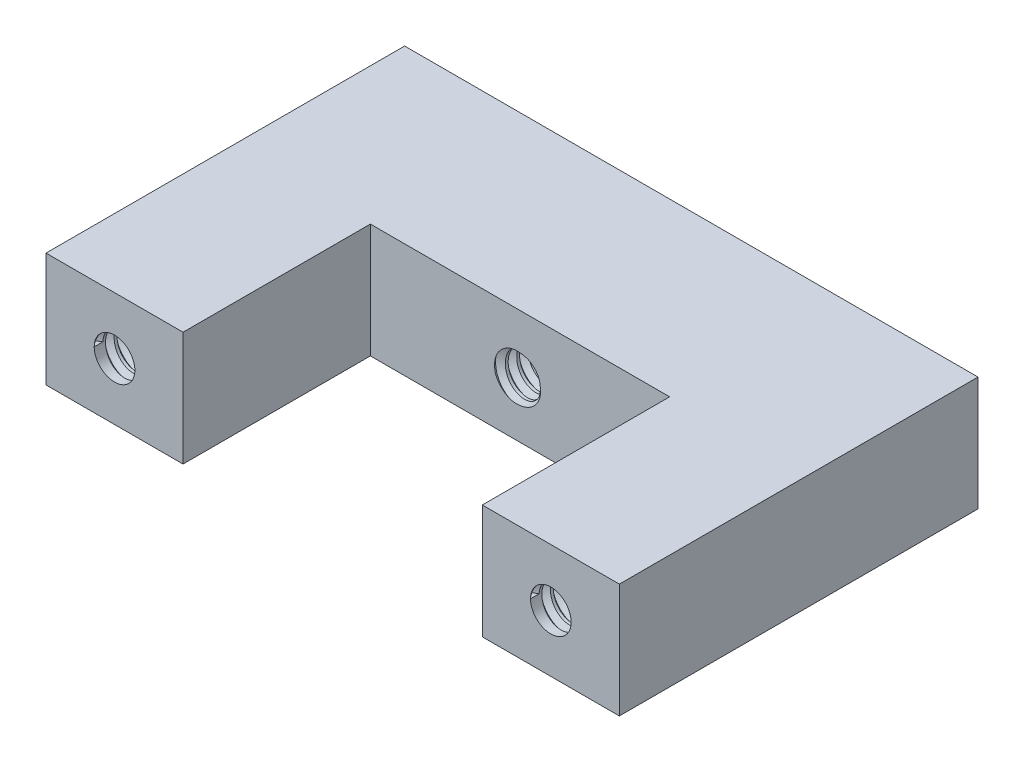
from build123d import *

# Parameters (mm, degrees)
BOSS_EXTRUDE1_DEPTH             = 6.35
F_43_0_089_DIAMETER_HOLE1_D     = 2.2606
THREAD1_PITCH                   = 0.635
F_43_0_089_DIAMETER_HOLE2_D     = 2.2606
F_43_0_089_DIAMETER_HOLE2_DEPTH = 7.62
F_43_0_089_DIAMETER_HOLE2_TIP   = 0.679152758
THREAD2_PITCH                   = 0.635
THREAD3_PITCH                   = 0.635


with BuildPart() as part:
    # Sketch1 → Boss-Extrude1 (new body)
    with BuildSketch(Plane(origin=(0, 0, 0), x_dir=(1, 0, 0), z_dir=(0, 1, 0))):
        Polygon((8.3185, -9.9695), (15.9385, -9.9695), (15.9385, 9.9695), (-15.9385, 9.9695), (-15.9385, -9.9695), (-8.3185, -9.9695), (-8.3185, 0.4445), (8.3185, 0.4445), align=None)
    extrude(amount=BOSS_EXTRUDE1_DEPTH)

    # #43 (0.089) Diameter Hole1 (through all)
    with Locations(Plane(origin=(0, 0, -9.9695), x_dir=(-1, 0, 0), z_dir=(0, 0, -1))):
        with Locations((0, 3.17519696)):
            Hole(F_43_0_089_DIAMETER_HOLE1_D / 2)

    # Thread1: the profile of Thread Profile1 profile screwed along a right-hand helix of 24.75 turns, 6 arcs to a turn; built about Z, then put on its axis
    thread1_z = Axis((0, 0, 0), (0, 0, 1))
    thread1_corners = [(1.13, 0, -0.000173205), (1.474003831, 0, 0.198437499), (1.474003831, 0, 0.277812499), (1.13, 0, 0.476423203)]
    with BuildLine(mode=Mode.PRIVATE) as thread1_profile:
        Line(thread1_corners[0], thread1_corners[1])
        Line(thread1_corners[1], thread1_corners[2])
        Line(thread1_corners[2], thread1_corners[3])
        Line(thread1_corners[3], thread1_corners[0])
    thread1_cap = Face(thread1_profile.wire())
    thread1_turn_angles = [0, 30, 60, 90, 120, 150, 180, 210, 240, 270, 300, 330, 360]
    thread1_turn_weights = [1, 0.8660254037844387, 1, 0.8660254037844387, 1, 0.8660254037844387, 1, 0.8660254037844387, 1, 0.8660254037844387, 1, 0.8660254037844387, 1]
    thread1_turn_rails = [Edge.make_bspline([Vector(p[0], p[1], 0).rotate(thread1_z, thread1_turn_angles[k]) / thread1_turn_weights[k] + Vector(0, 0, p[2] + THREAD1_PITCH * thread1_turn_angles[k] / 360) for k in range(13)], [0, 0, 0, 1, 1, 2, 2, 3, 3, 4, 4, 5, 5, 6, 6, 6], 2, thread1_turn_weights) for p in thread1_corners]
    thread1_turn_sides = [Face.make_surface_from_curves(thread1_turn_rails[p[0]], thread1_turn_rails[p[1]]) for p in [(0, 1), (1, 2), (2, 3), (3, 0)]]
    thread1_last_angles = [8640, 8670, 8700, 8730, 8760, 8790, 8820, 8850, 8880, 8895, 8910]
    thread1_last_weights = [1, 0.8660254037844387, 1, 0.8660254037844387, 1, 0.8660254037844387, 1, 0.8660254037844387, 1, 0.9659258262890683, 1]
    thread1_last_rails = [Edge.make_bspline([Vector(p[0], p[1], 0).rotate(thread1_z, thread1_last_angles[k]) / thread1_last_weights[k] + Vector(0, 0, p[2] + THREAD1_PITCH * thread1_last_angles[k] / 360) for k in range(11)], [0, 0, 0, 1, 1, 2, 2, 3, 3, 4, 4, 5, 5, 5], 2, thread1_last_weights) for p in thread1_corners]
    thread1_last_sides = [Face.make_surface_from_curves(thread1_last_rails[p[0]], thread1_last_rails[p[1]]) for p in [(0, 1), (1, 2), (2, 3), (3, 0)]]
    thread1 = Plane(origin=(0, 3.17519696, -9.9695), x_dir=(1, 0, 0), z_dir=(0, 0, 1)) * Solid(Shell([*[p.moved(Location((0, 0, THREAD1_PITCH * i))) for i in range(24) for p in thread1_turn_sides], *thread1_last_sides, thread1_cap, thread1_cap.rotate(thread1_z, 8910).moved(Location((0, 0, THREAD1_PITCH * 8910 / 360)))]))
    add(thread1, mode=Mode.SUBTRACT)

    # #43 (0.089) Diameter Hole2
    with Locations(Plane.XY.offset(9.9695)):
        with Locations((12.1285, 3.175), (-12.1285, 3.175)):
            Hole(F_43_0_089_DIAMETER_HOLE2_D / 2, depth=F_43_0_089_DIAMETER_HOLE2_DEPTH)
            with Locations((0, 0, -(F_43_0_089_DIAMETER_HOLE2_DEPTH + F_43_0_089_DIAMETER_HOLE2_TIP / 2))):  # 118° drill point
                Cone(0, F_43_0_089_DIAMETER_HOLE2_D / 2, F_43_0_089_DIAMETER_HOLE2_TIP, mode=Mode.SUBTRACT)

    # Thread2: the profile of Thread Profile2 profile screwed along a right-hand helix of 8.75 turns, 6 arcs to a turn; built about Z, then put on its axis
    thread2_z = Axis((0, 0, 0), (0, 0, 1))
    thread2_corners = [(1.13, 0, -0.000173205), (1.474003831, 0, 0.198437499), (1.474003831, 0, 0.277812499), (1.13, 0, 0.476423203)]
    with BuildLine(mode=Mode.PRIVATE) as thread2_profile:
        Line(thread2_corners[0], thread2_corners[1])
        Line(thread2_corners[1], thread2_corners[2])
        Line(thread2_corners[2], thread2_corners[3])
        Line(thread2_corners[3], thread2_corners[0])
    thread2_cap = Face(thread2_profile.wire())
    thread2_turn_angles = [0, 30, 60, 90, 120, 150, 180, 210, 240, 270, 300, 330, 360]
    thread2_turn_weights = [1, 0.8660254037844387, 1, 0.8660254037844387, 1, 0.8660254037844387, 1, 0.8660254037844387, 1, 0.8660254037844387, 1, 0.8660254037844387, 1]
    thread2_turn_rails = [Edge.make_bspline([Vector(p[0], p[1], 0).rotate(thread2_z, thread2_turn_angles[k]) / thread2_turn_weights[k] + Vector(0, 0, p[2] + THREAD2_PITCH * thread2_turn_angles[k] / 360) for k in range(13)], [0, 0, 0, 1, 1, 2, 2, 3, 3, 4, 4, 5, 5, 6, 6, 6], 2, thread2_turn_weights) for p in thread2_corners]
    thread2_turn_sides = [Face.make_surface_from_curves(thread2_turn_rails[p[0]], thread2_turn_rails[p[1]]) for p in [(0, 1), (1, 2), (2, 3), (3, 0)]]
    thread2_last_angles = [2880, 2910, 2940, 2970, 3000, 3030, 3060, 3090, 3120, 3135, 3150]
    thread2_last_weights = [1, 0.8660254037844387, 1, 0.8660254037844387, 1, 0.8660254037844387, 1, 0.8660254037844387, 1, 0.9659258262890693, 1]
    thread2_last_rails = [Edge.make_bspline([Vector(p[0], p[1], 0).rotate(thread2_z, thread2_last_angles[k]) / thread2_last_weights[k] + Vector(0, 0, p[2] + THREAD2_PITCH * thread2_last_angles[k] / 360) for k in range(11)], [0, 0, 0, 1, 1, 2, 2, 3, 3, 4, 4, 5, 5, 5], 2, thread2_last_weights) for p in thread2_corners]
    thread2_last_sides = [Face.make_surface_from_curves(thread2_last_rails[p[0]], thread2_last_rails[p[1]]) for p in [(0, 1), (1, 2), (2, 3), (3, 0)]]
    thread2 = Plane(origin=(-12.1285, 3.175, 9.9695), x_dir=(-1, 0, 0), z_dir=(0, 0, -1)) * Solid(Shell([*[p.moved(Location((0, 0, THREAD2_PITCH * i))) for i in range(8) for p in thread2_turn_sides], *thread2_last_sides, thread2_cap, thread2_cap.rotate(thread2_z, 3150).moved(Location((0, 0, THREAD2_PITCH * 3150 / 360)))]))
    add(thread2, mode=Mode.SUBTRACT)

    # Thread3: the profile of Thread Profile3 profile screwed along a right-hand helix of 8.75 turns, 6 arcs to a turn; built about Z, then put on its axis
    thread3_z = Axis((0, 0, 0), (0, 0, 1))
    thread3_corners = [(1.13, 0, -0.000173205), (1.474003831, 0, 0.198437499), (1.474003831, 0, 0.277812499), (1.13, 0, 0.476423203)]
    with BuildLine(mode=Mode.PRIVATE) as thread3_profile:
        Line(thread3_corners[0], thread3_corners[1])
        Line(thread3_corners[1], thread3_corners[2])
        Line(thread3_corners[2], thread3_corners[3])
        Line(thread3_corners[3], thread3_corners[0])
    thread3_cap = Face(thread3_profile.wire())
    thread3_turn_angles = [0, 30, 60, 90, 120, 150, 180, 210, 240, 270, 300, 330, 360]
    thread3_turn_weights = [1, 0.8660254037844387, 1, 0.8660254037844387, 1, 0.8660254037844387, 1, 0.8660254037844387, 1, 0.8660254037844387, 1, 0.8660254037844387, 1]
    thread3_turn_rails = [Edge.make_bspline([Vector(p[0], p[1], 0).rotate(thread3_z, thread3_turn_angles[k]) / thread3_turn_weights[k] + Vector(0, 0, p[2] + THREAD3_PITCH * thread3_turn_angles[k] / 360) for k in range(13)], [0, 0, 0, 1, 1, 2, 2, 3, 3, 4, 4, 5, 5, 6, 6, 6], 2, thread3_turn_weights) for p in thread3_corners]
    thread3_turn_sides = [Face.make_surface_from_curves(thread3_turn_rails[p[0]], thread3_turn_rails[p[1]]) for p in [(0, 1), (1, 2), (2, 3), (3, 0)]]
    thread3_last_angles = [2880, 2910, 2940, 2970, 3000, 3030, 3060, 3090, 3120, 3135, 3150]
    thread3_last_weights = [1, 0.8660254037844387, 1, 0.8660254037844387, 1, 0.8660254037844387, 1, 0.8660254037844387, 1, 0.9659258262890693, 1]
    thread3_last_rails = [Edge.make_bspline([Vector(p[0], p[1], 0).rotate(thread3_z, thread3_last_angles[k]) / thread3_last_weights[k] + Vector(0, 0, p[2] + THREAD3_PITCH * thread3_last_angles[k] / 360) for k in range(11)], [0, 0, 0, 1, 1, 2, 2, 3, 3, 4, 4, 5, 5, 5], 2, thread3_last_weights) for p in thread3_corners]
    thread3_last_sides = [Face.make_surface_from_curves(thread3_last_rails[p[0]], thread3_last_rails[p[1]]) for p in [(0, 1), (1, 2), (2, 3), (3, 0)]]
    thread3 = Plane(origin=(12.1285, 3.175, 9.9695), x_dir=(-1, 0, 0), z_dir=(0, 0, -1)) * Solid(Shell([*[p.moved(Location((0, 0, THREAD3_PITCH * i))) for i in range(8) for p in thread3_turn_sides], *thread3_last_sides, thread3_cap, thread3_cap.rotate(thread3_z, 3150).moved(Location((0, 0, THREAD3_PITCH * 3150 / 360)))]))
    add(thread3, mode=Mode.SUBTRACT)


solid = part.part
